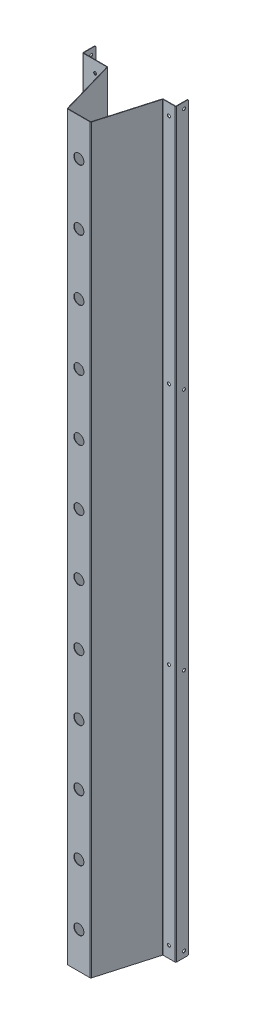
from build123d import *

# Parameters (mm, degrees)
BASE_FLANGE1_DEPTH = 1613
FILLET1_R          = 3
CUT_EXTRUDE1_REACH = 1625.966
SKETCH6_R          = 11
LPATTERN1_COUNT    = 15
LPATTERN1_PITCH    = 132
CUT_EXTRUDE4_REACH = 1634.045
SKETCH10_R         = 3.25
LPATTERN5_COUNT    = 4
LPATTERN5_PITCH    = 529
CUT_EXTRUDE5_REACH = 1623.619
CUT_EXTRUDE6_REACH = 1623.619
SKETCH13_R         = 3.25
CUT_EXTRUDE7_REACH = 1623.619
SKETCH14_R         = 3.25
LPATTERN6_COUNT    = 3
LPATTERN6_PITCH    = 529
CUT_EXTRUDE8_REACH = 1623.619
SKETCH15_R         = 3.25


# Sheet-metal steps are written as plain solids
with BuildPart() as part:
    # Sketch1 → Base-Flange1 (new body)
    with BuildSketch(Plane(origin=(0, 0, 0), x_dir=(1, 0, 0), z_dir=(0, 1, 0))):
        with BuildLine():
            Line((-113, 149), (-113, 123))
            ThreePointArc((-113, 123), (-112.707106781, 122.292893219), (-112, 122))
            Line((-112, 122), (-61.506905499, 122))
            ThreePointArc((-61.506905499, 122), (-60.303378662, 121.597348789), (-59.584453364, 120.551523153))
            Line((-59.584453364, 120.551523153), (-25.207773318, 0.724238423))
            ThreePointArc((-25.207773318, 0.724238423), (-24.848310669, 0.201325606), (-24.246547251, 0))
            Line((-24.246547251, 0), (24.246547251, 0))
            ThreePointArc((24.246547251, 0), (24.848310669, 0.201325606), (25.207773318, 0.724238423))
            Line((25.207773318, 0.724238423), (59.584453364, 120.551523153))
            ThreePointArc((59.584453364, 120.551523153), (60.303378662, 121.597348789), (61.506905499, 122))
            Line((61.506905499, 122), (87, 122))
            ThreePointArc((87, 122), (87.707106781, 122.292893219), (88, 123))
            Line((88, 123), (88, 149))
            Line((88, 149), (89, 149))
            Line((89, 149), (89, 123))
            ThreePointArc((89, 123), (88.414213562, 121.585786438), (87, 121))
            Line((87, 121), (61.506905499, 121))
            ThreePointArc((61.506905499, 121), (60.90514208, 120.798674394), (60.545679431, 120.275761577))
            Line((60.545679431, 120.275761577), (26.168999386, 0.448476847))
            ThreePointArc((26.168999386, 0.448476847), (25.450074087, -0.597348789), (24.246547251, -1))
            Line((24.246547251, -1), (-24.246547251, -1))
            ThreePointArc((-24.246547251, -1), (-25.450074087, -0.597348789), (-26.168999386, 0.448476847))
            Line((-26.168999386, 0.448476847), (-60.545679431, 120.275761577))
            ThreePointArc((-60.545679431, 120.275761577), (-60.90514208, 120.798674394), (-61.506905499, 121))
            Line((-61.506905499, 121), (-112, 121))
            ThreePointArc((-112, 121), (-113.414213562, 121.585786438), (-114, 123))
            Line((-114, 123), (-114, 149))
            Line((-114, 149), (-113, 149))
        make_face()
    extrude(amount=BASE_FLANGE1_DEPTH)

    # Fillet1
    fillet1_edges = [part.edges().sort_by_distance(p)[0] for p in [
        (-113.5, 0, -149),
        (88.5, 0, -149),
        (-113.5, 1613, -149),
        (88.5, 1613, -149),
    ]]
    fillet(fillet1_edges, radius=FILLET1_R)

    # Sketch6 → Cut-Extrude1 (cut, up to next)
    with BuildSketch(Plane.XY.offset(1), mode=Mode.PRIVATE) as cut_extrude1_sk1:
        with Locations((0, 79)):
            Circle(SKETCH6_R)
    cut_extrude1_tool1 = extrude(cut_extrude1_sk1.sketch, amount=-CUT_EXTRUDE1_REACH, mode=Mode.PRIVATE) & part.part
    cut_extrude1 = cut_extrude1_tool1.solids().sort_by_distance((0, 79, 1))[0]
    add(cut_extrude1, mode=Mode.SUBTRACT)

    # LPattern1: Cut-Extrude1 ×15
    with Locations(*[(0, i * LPATTERN1_PITCH, 0) for i in range(1, LPATTERN1_COUNT)]):
        add(cut_extrude1, mode=Mode.SUBTRACT)

    # Cut-Extrude4: up to this face of the body (flat: up to its plane)
    cut_extrude4_end = Plane(part.part.faces().sort_by_distance((-114, 806.5, -135.998864211))[0])
    # Sketch10 → Cut-Extrude4 (cut, up to the picked face)
    with BuildSketch(Plane(origin=(89, 0, -5.5), x_dir=(0, 0, -1), z_dir=(1, 0, 0)), mode=Mode.PRIVATE) as cut_extrude4_sk1:
        with Locations((133.5, 13)):
            Circle(SKETCH10_R)
    cut_extrude4_tool1 = split(extrude(cut_extrude4_sk1.sketch, amount=-CUT_EXTRUDE4_REACH, mode=Mode.PRIVATE), bisect_by=cut_extrude4_end, keep=Keep.BOTH, mode=Mode.PRIVATE)
    cut_extrude4 = cut_extrude4_tool1.solids().sort_by(Axis((89, 13, -139), (-1, 0, 0)))[0]
    add(cut_extrude4, mode=Mode.SUBTRACT)

    # LPattern5: Cut-Extrude4 ×4
    with Locations(*[(0, i * LPATTERN5_PITCH, 0) for i in range(1, LPATTERN5_COUNT)]):
        add(cut_extrude4, mode=Mode.SUBTRACT)

    # Sketch12 → Cut-Extrude5 (cut, up to next)
    with BuildSketch(Plane.XY.offset(-121), mode=Mode.PRIVATE) as cut_extrude5_sk1:
        with BuildLine():
            Line((-100.006905499, 99.5), (-100.006905499, 124.5))
            ThreePointArc((-100.006905499, 124.5), (-85.006905499, 139.5), (-70.006905499, 124.5))
            Line((-70.006905499, 124.5), (-70.006905499, 99.5))
            ThreePointArc((-70.006905499, 99.5), (-85.006905499, 84.5), (-100.006905499, 99.5))
        make_face()
    cut_extrude5_tool1 = extrude(cut_extrude5_sk1.sketch, amount=-CUT_EXTRUDE5_REACH, mode=Mode.PRIVATE) & part.part
    # Sketch12 → Cut-Extrude5 (cut, up to next)
    with BuildSketch(Plane.XY.offset(-121), mode=Mode.PRIVATE) as cut_extrude5_sk2:
        with BuildLine():
            Line((-100.006905499, 1187.5), (-100.006905499, 1212.5))
            ThreePointArc((-100.006905499, 1212.5), (-85.006905499, 1227.5), (-70.006905499, 1212.5))
            Line((-70.006905499, 1212.5), (-70.006905499, 1187.5))
            ThreePointArc((-70.006905499, 1187.5), (-85.006905499, 1172.5), (-100.006905499, 1187.5))
        make_face()
    cut_extrude5_tool2 = extrude(cut_extrude5_sk2.sketch, amount=-CUT_EXTRUDE5_REACH, mode=Mode.PRIVATE) & part.part
    # Sketch12 → Cut-Extrude5 (cut, up to next)
    with BuildSketch(Plane.XY.offset(-121), mode=Mode.PRIVATE) as cut_extrude5_sk3:
        with BuildLine():
            Line((-70.006905499, 1512.5), (-70.006905499, 1487.5))
            ThreePointArc((-70.006905499, 1487.5), (-85.006905499, 1472.5), (-100.006905499, 1487.5))
            Line((-100.006905499, 1487.5), (-100.006905499, 1512.5))
            ThreePointArc((-100.006905499, 1512.5), (-85.006905499, 1527.5), (-70.006905499, 1512.5))
        make_face()
    cut_extrude5_tool3 = extrude(cut_extrude5_sk3.sketch, amount=-CUT_EXTRUDE5_REACH, mode=Mode.PRIVATE) & part.part
    add(cut_extrude5_tool1.solids().sort_by_distance((-85.006905, 112, -121))[0], mode=Mode.SUBTRACT)
    add(cut_extrude5_tool2.solids().sort_by_distance((-85.006905, 1200, -121))[0], mode=Mode.SUBTRACT)
    add(cut_extrude5_tool3.solids().sort_by_distance((-85.006905, 1500, -121))[0], mode=Mode.SUBTRACT)

    # Sketch13 → Cut-Extrude6 (cut, up to next)
    with BuildSketch(Plane.XY.offset(-121), mode=Mode.PRIVATE) as cut_extrude6_sk1:
        with Locations((-86.506905499, 25)):
            Circle(SKETCH13_R)
    cut_extrude6_tool1 = extrude(cut_extrude6_sk1.sketch, amount=-CUT_EXTRUDE6_REACH, mode=Mode.PRIVATE) & part.part
    cut_extrude6 = cut_extrude6_tool1.solids().sort_by_distance((-86.506905, 25, -121))[0]
    add(cut_extrude6, mode=Mode.SUBTRACT)

    # Sketch14 → Cut-Extrude7 (cut, up to next)
    with BuildSketch(Plane.XY.offset(-121), mode=Mode.PRIVATE) as cut_extrude7_sk1:
        with Locations((74.006905499, 25)):
            Circle(SKETCH14_R)
    cut_extrude7_tool1 = extrude(cut_extrude7_sk1.sketch, amount=-CUT_EXTRUDE7_REACH, mode=Mode.PRIVATE) & part.part
    cut_extrude7 = cut_extrude7_tool1.solids().sort_by_distance((74.006905, 25, -121))[0]
    add(cut_extrude7, mode=Mode.SUBTRACT)

    # LPattern6: Cut-Extrude6, Cut-Extrude7 ×3
    with Locations(*[(0, i * LPATTERN6_PITCH, 0) for i in range(1, LPATTERN6_COUNT)]):
        add(cut_extrude6, mode=Mode.SUBTRACT)
        add(cut_extrude7, mode=Mode.SUBTRACT)

    # Sketch15 → Cut-Extrude8 (cut, up to next)
    with BuildSketch(Plane.XY.offset(-121), mode=Mode.PRIVATE) as cut_extrude8_sk1:
        with Locations((-86.506905499, 1588)):
            Circle(SKETCH15_R)
    cut_extrude8_tool1 = extrude(cut_extrude8_sk1.sketch, amount=-CUT_EXTRUDE8_REACH, mode=Mode.PRIVATE) & part.part
    # Sketch15 → Cut-Extrude8 (cut, up to next)
    with BuildSketch(Plane.XY.offset(-121), mode=Mode.PRIVATE) as cut_extrude8_sk2:
        with Locations((74.006905499, 1588)):
            Circle(SKETCH15_R)
    cut_extrude8_tool2 = extrude(cut_extrude8_sk2.sketch, amount=-CUT_EXTRUDE8_REACH, mode=Mode.PRIVATE) & part.part
    add(cut_extrude8_tool1.solids().sort_by_distance((-86.506905, 1588, -121))[0], mode=Mode.SUBTRACT)
    add(cut_extrude8_tool2.solids().sort_by_distance((74.006905, 1588, -121))[0], mode=Mode.SUBTRACT)


solid = part.part
